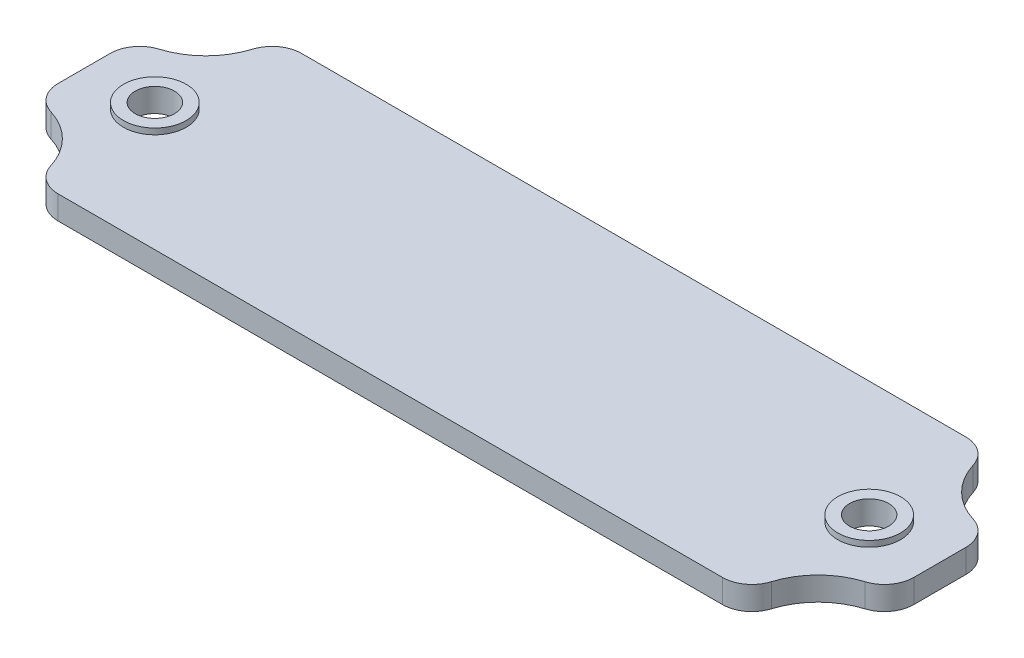
from build123d import *
from build123d.topology import SkipClean

# Parameters (mm, degrees)
SKETCH2_R           = 2.5
BOSS_EXTRUDE1_DEPTH = 0.75
BOSS_EXTRUDE2_DEPTH = 3
SKETCH4_R           = 4
SKETCH4_R_2         = 2.5
BOSS_EXTRUDE3_DEPTH = 1.5


with BuildPart() as part:
    # Sketch2 → Boss-Extrude1 (new, symmetric)
    with BuildSketch(Plane(origin=(0, 0, 0), x_dir=(1, 0, 0), z_dir=(0, 1, 0))):
        with BuildLine():
            Line((-42.313942393, -15.5), (42.313942393, -15.5))
            ThreePointArc((42.313942393, -15.5), (44.541774365, -14.76649875), (45.898076983, -12.852941176))
            ThreePointArc((45.898076983, -12.852941176), (48.136038969, -9.136038969), (51.852941176, -6.898076983))
            ThreePointArc((51.852941176, -6.898076983), (53.76649875, -5.541774365), (54.5, -3.313942393))
            Line((54.5, -3.313942393), (54.5, 3.313942393))
            ThreePointArc((54.5, 3.313942393), (53.76649875, 5.541774365), (51.852941176, 6.898076983))
            ThreePointArc((51.852941176, 6.898076983), (48.136038969, 9.136038969), (45.898076983, 12.852941176))
            ThreePointArc((45.898076983, 12.852941176), (44.541774365, 14.76649875), (42.313942393, 15.5))
            Line((42.313942393, 15.5), (-42.313942393, 15.5))
            ThreePointArc((-42.313942393, 15.5), (-44.541774365, 14.76649875), (-45.898076983, 12.852941176))
            ThreePointArc((-45.898076983, 12.852941176), (-48.136038969, 9.136038969), (-51.852941176, 6.898076983))
            ThreePointArc((-51.852941176, 6.898076983), (-53.76649875, 5.541774365), (-54.5, 3.313942393))
            Line((-54.5, 3.313942393), (-54.5, -3.313942393))
            ThreePointArc((-54.5, -3.313942393), (-53.76649875, -5.541774365), (-51.852941176, -6.898076983))
            ThreePointArc((-51.852941176, -6.898076983), (-48.136038969, -9.136038969), (-45.898076983, -12.852941176))
            ThreePointArc((-45.898076983, -12.852941176), (-44.541774365, -14.76649875), (-42.313942393, -15.5))
        make_face()
        with Locations((-45.5, 0)):
            Circle(SKETCH2_R, mode=Mode.SUBTRACT)
        with Locations((45.5, 0)):
            Circle(SKETCH2_R, mode=Mode.SUBTRACT)
    extrude(amount=BOSS_EXTRUDE1_DEPTH, both=True)

    # Sketch3 → Boss-Extrude2 (add)
    with SkipClean():  # the faces are left unmerged after this step: merging them gives an invalid solid
        with BuildSketch(Plane.XZ.offset(-0.75)):
            with BuildLine():
                Line((54.5, -3.313942393), (54.5, 3.313942393))
                ThreePointArc((54.5, 3.313942393), (53.76649875, 5.541774365), (51.852941176, 6.898076983))
                ThreePointArc((51.852941176, 6.898076983), (48.136038969, 9.136038969), (45.898076983, 12.852941176))
                ThreePointArc((45.898076983, 12.852941176), (44.541774365, 14.76649875), (42.313942393, 15.5))
                Line((42.313942393, 15.5), (-42.313942393, 15.5))
                ThreePointArc((-42.313942393, 15.5), (-44.541774365, 14.76649875), (-45.898076983, 12.852941176))
                ThreePointArc((-45.898076983, 12.852941176), (-48.136038969, 9.136038969), (-51.852941176, 6.898076983))
                ThreePointArc((-51.852941176, 6.898076983), (-53.76649875, 5.541774365), (-54.5, 3.313942393))
                Line((-54.5, 3.313942393), (-54.5, -3.313942393))
                ThreePointArc((-54.5, -3.313942393), (-53.76649875, -5.541774365), (-51.852941176, -6.898076983))
                ThreePointArc((-51.852941176, -6.898076983), (-48.136038969, -9.136038969), (-45.898076983, -12.852941176))
                ThreePointArc((-45.898076983, -12.852941176), (-44.541774365, -14.76649875), (-42.313942393, -15.5))
                Line((-42.313942393, -15.5), (42.313942393, -15.5))
                ThreePointArc((42.313942393, -15.5), (44.541774365, -14.76649875), (45.898076983, -12.852941176))
                ThreePointArc((45.898076983, -12.852941176), (48.136038969, -9.136038969), (51.852941176, -6.898076983))
                ThreePointArc((51.852941176, -6.898076983), (53.76649875, -5.541774365), (54.5, -3.313942393))
            make_face()
            with BuildLine():
                Line((53, -3.313942393), (53, 3.313942393))
                ThreePointArc((53, 3.313942393), (52.55989925, 4.650641576), (51.411764706, 5.464423147))
                ThreePointArc((51.411764706, 5.464423147), (47.075378798, 8.075378798), (44.464423147, 12.411764706))
                ThreePointArc((44.464423147, 12.411764706), (43.650641576, 13.55989925), (42.313942393, 14))
                Line((42.313942393, 14), (-42.313942393, 14))
                ThreePointArc((-42.313942393, 14), (-43.650641576, 13.55989925), (-44.464423147, 12.411764706))
                ThreePointArc((-44.464423147, 12.411764706), (-47.075378798, 8.075378798), (-51.411764706, 5.464423147))
                ThreePointArc((-51.411764706, 5.464423147), (-52.55989925, 4.650641576), (-53, 3.313942393))
                Line((-53, 3.313942393), (-53, -3.313942393))
                ThreePointArc((-53, -3.313942393), (-52.55989925, -4.650641576), (-51.411764706, -5.464423147))
                ThreePointArc((-51.411764706, -5.464423147), (-47.075378798, -8.075378798), (-44.464423147, -12.411764706))
                ThreePointArc((-44.464423147, -12.411764706), (-43.650641576, -13.55989925), (-42.313942393, -14))
                Line((-42.313942393, -14), (42.313942393, -14))
                ThreePointArc((42.313942393, -14), (43.650641576, -13.55989925), (44.464423147, -12.411764706))
                ThreePointArc((44.464423147, -12.411764706), (47.075378798, -8.075378798), (51.411764706, -5.464423147))
                ThreePointArc((51.411764706, -5.464423147), (52.55989925, -4.650641576), (53, -3.313942393))
            make_face(mode=Mode.SUBTRACT)
        extrude(amount=BOSS_EXTRUDE2_DEPTH)
    add(part.part.scale(1), mode=Mode.REPLACE)  # the faces are merged on a copy

    # Sketch4 → Boss-Extrude3 (add, symmetric)
    # profile 1 of 2: a face of its own
    with BuildSketch(Plane(origin=(0, 0, 0), x_dir=(1, 0, 0), z_dir=(0, 1, 0))):
        with Locations((-45.5, 0)):
            Circle(SKETCH4_R)
        with Locations((-45.5, 0)):
            Circle(SKETCH4_R_2, mode=Mode.SUBTRACT)
    # profile 2 of 2: a face of its own
    with BuildSketch(Plane(origin=(0, 0, 0), x_dir=(1, 0, 0), z_dir=(0, 1, 0))):
        with Locations((45.5, 0)):
            Circle(SKETCH4_R)
        with Locations((45.5, 0)):
            Circle(SKETCH4_R_2, mode=Mode.SUBTRACT)
    extrude(amount=BOSS_EXTRUDE3_DEPTH, both=True)


solid = part.part
